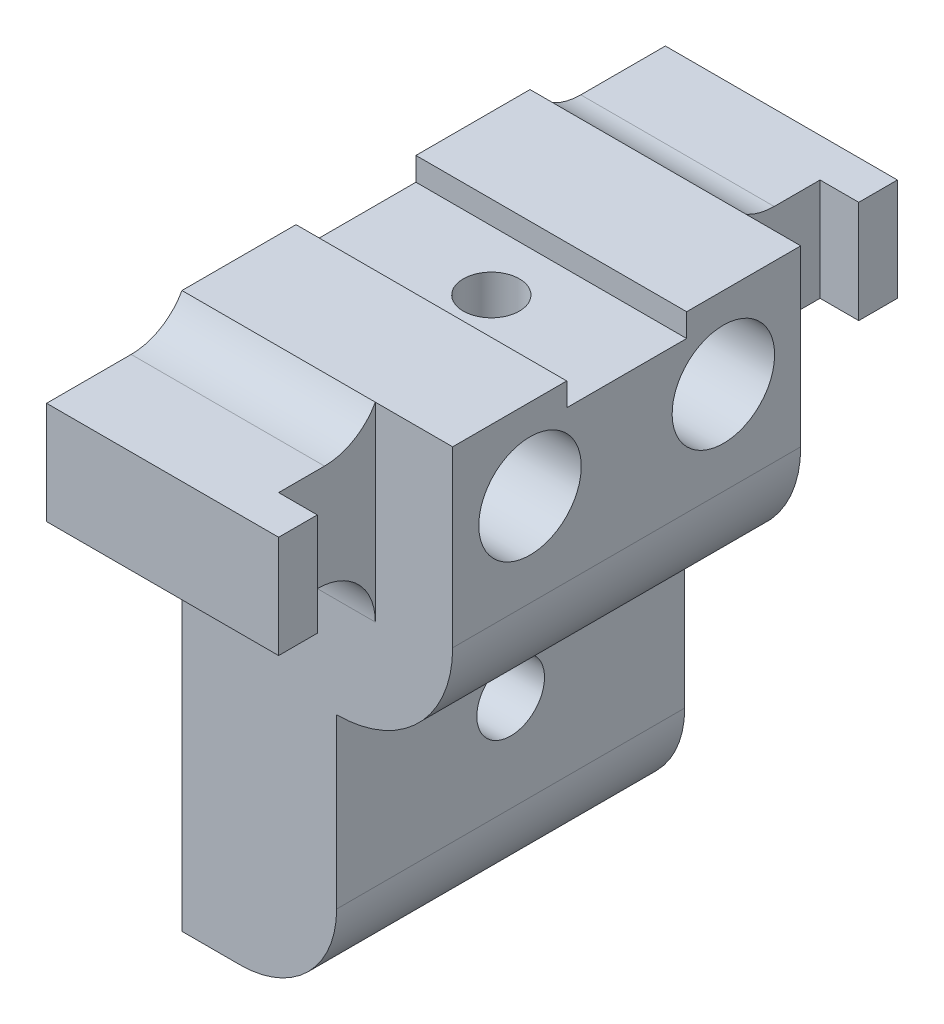
from build123d import *

# Parameters (mm, degrees)
SKETCH1_W               = 6
SKETCH1_H               = 15
SKETCH1_W_2             = 8
SKETCH1_H_2             = 28.7
BOSS_EXTRUDE1_DEPTH     = 9
SKETCH2_R               = 2.65
CUT_EXTRUDE1_DEPTH      = 34.176648414
SKETCH5_W               = 10
SKETCH5_H               = 5.3
BOSS_EXTRUDE4_DEPTH     = 5
SKETCH6_W               = 12
SKETCH6_H               = 5.3
BOSS_EXTRUDE5_DEPTH     = 2
SKETCH7_W               = 14
SKETCH7_H               = 6.2
CUT_EXTRUDE2_DEPTH      = 1.2
SKETCH8_R               = 1.45
CUT_EXTRUDE3_DEPTH      = 8
CUT_EXTRUDE4_DEPTH      = 36.716802768
CUT_EXTRUDE4_DEPTH_BACK = 36.716802768
SKETCH9_R               = 1.75
FILLET1_R               = 5
FILLET2_R               = 6
FILLET3_R               = 3


# Some blends are built 0.0001 mm under size
with BuildPart() as part:
    # Sketch1 → Boss-Extrude1 (new, symmetric)
    with BuildSketch(Plane.XY):
        with Locations((11, -7.5)):
            Rectangle(SKETCH1_W, SKETCH1_H)
        with Locations((4, -14.35)):
            Rectangle(SKETCH1_W_2, SKETCH1_H_2)
    extrude(amount=BOSS_EXTRUDE1_DEPTH, both=True)

    # Sketch2 → Cut-Extrude1 (cut, through all)
    with BuildSketch(Plane(origin=(14, 0, 0), x_dir=(0, 0, -1), z_dir=(1, 0, 0))):
        with Locations(Location((5, -4.2, 0), (0, 0, 90))):
            Circle(SKETCH2_R)
        with Locations(Location((-5, -4.2, 0), (0, 0, 90))):
            Circle(SKETCH2_R)
    extrude(amount=-CUT_EXTRUDE1_DEPTH, mode=Mode.SUBTRACT)

    # Sketch5 → Boss-Extrude4 (add)
    with BuildSketch(Plane.XY.offset(9)):
        with Locations((5, -4.2)):
            Rectangle(SKETCH5_W, SKETCH5_H)
    boss_extrude4 = extrude(amount=BOSS_EXTRUDE4_DEPTH)

    # Sketch6 → Boss-Extrude5 (add)
    with BuildSketch(Plane.XY.offset(14)):
        with Locations((6, -4.2)):
            Rectangle(SKETCH6_W, SKETCH6_H)
    boss_extrude5 = extrude(amount=BOSS_EXTRUDE5_DEPTH)

    # Mirror2: Boss-Extrude4, Boss-Extrude5 across plane
    add(boss_extrude4.mirror(Plane.XY))
    add(boss_extrude5.mirror(Plane.XY))

    # Sketch7 → Cut-Extrude2 (cut)
    with BuildSketch(Plane(origin=(0, 0, 0), x_dir=(1, 0, 0), z_dir=(0, 1, 0))):
        with Locations((7, 0)):
            Rectangle(SKETCH7_W, SKETCH7_H)
    extrude(amount=-CUT_EXTRUDE2_DEPTH, mode=Mode.SUBTRACT)

    # Sketch8 → Cut-Extrude3 (cut)
    with BuildSketch(Plane(origin=(0, -1.2, 0), x_dir=(1, 0, 0), z_dir=(0, 1, 0))):
        with Locations(Location((7, 0, 0), (0, 0, 270))):
            Circle(SKETCH8_R)
    extrude(amount=-CUT_EXTRUDE3_DEPTH, mode=Mode.SUBTRACT)

    # Sketch9 → Cut-Extrude4 (cut, two sides: drawn at the far end of the back side and taken through both)
    with BuildSketch(Plane.ZY.offset(-CUT_EXTRUDE4_DEPTH_BACK)):
        with Locations(Location((0, -18.7, 0), (0, 0, 90))):
            Circle(SKETCH9_R)
    extrude(amount=CUT_EXTRUDE4_DEPTH + CUT_EXTRUDE4_DEPTH_BACK, mode=Mode.SUBTRACT)

    # Fillet1
    fillet1_edges = [part.edges().sort_by_distance(p)[0] for p in [
        (8, -28.7, 0),
    ]]
    fillet(fillet1_edges, radius=FILLET1_R)

    # Fillet2
    fillet2_edges = [part.edges().sort_by_distance(p)[0] for p in [
        (14, -15, 0),
    ]]
    fillet(fillet2_edges, radius=FILLET2_R - 0.0001)  # a hair under: the kernel refuses the full size

    # Fillet3
    # the kernel refuses this fillet: 3 mm, written as the material it adds along each edge
    with BuildSketch(Plane(origin=(10, -6.85, 9), x_dir=(0, -1, 0), z_dir=(-1, 0, 0))) as fillet3_piece_1:
        with BuildLine():
            CenterArc((FILLET3_R, FILLET3_R), FILLET3_R, 180, 90)
            Line((0, FILLET3_R), (-FILLET3_R * 0.02, FILLET3_R))
            Line((-FILLET3_R * 0.02, FILLET3_R), (-FILLET3_R * 0.02, -FILLET3_R * 0.02))
            Line((-FILLET3_R * 0.02, -FILLET3_R * 0.02), (FILLET3_R, -FILLET3_R * 0.02))
            Line((FILLET3_R, -FILLET3_R * 0.02), (FILLET3_R, 0))
        make_face()
    extrude(amount=10)
    with BuildSketch(Plane(origin=(0, -1.55, 9), x_dir=(0, 1, 0), z_dir=(1, 0, 0))) as fillet3_piece_2:
        with BuildLine():
            CenterArc((3, 2.626309197), FILLET3_R, 180, 61.09666546)
            Line((0, 2.626309197), (-0.06, 2.626309197))
            Line((-0.06, 2.626309197), (-0.06, 0))
            Line((-0.06, 0), (0, -0.06))
            ThreePointArc((0, -0.06), (0.775, -0.06), (1.521, -0.052526184))
            Line((1.521, -0.052526184), (1.55, 0))
        make_face()
    extrude(amount=10)
    with BuildSketch(Plane(origin=(10, -6.85, -9), x_dir=(0, -1, 0), z_dir=(-1, 0, 0))) as fillet3_piece_3:
        with BuildLine():
            CenterArc((FILLET3_R, -FILLET3_R), FILLET3_R, 90, 90)
            Line((0, -FILLET3_R), (-FILLET3_R * 0.02, -FILLET3_R))
            Line((-FILLET3_R * 0.02, -FILLET3_R), (-FILLET3_R * 0.02, FILLET3_R * 0.02))
            Line((-FILLET3_R * 0.02, FILLET3_R * 0.02), (FILLET3_R, FILLET3_R * 0.02))
            Line((FILLET3_R, FILLET3_R * 0.02), (FILLET3_R, 0))
        make_face()
    extrude(amount=10)
    with BuildSketch(Plane(origin=(0, -1.55, -9), x_dir=(0, 1, 0), z_dir=(1, 0, 0))) as fillet3_piece_4:
        with BuildLine():
            CenterArc((3, -2.626309197), FILLET3_R, 118.90333454, 61.09666546)
            Line((0, -2.626309197), (-0.06, -2.626309197))
            Line((-0.06, -2.626309197), (-0.06, 0))
            Line((-0.06, 0), (0, 0.06))
            ThreePointArc((0, 0.06), (0.775, 0.06), (1.521, 0.052526184))
            Line((1.521, 0.052526184), (1.55, 0))
        make_face()
    extrude(amount=10)


solid = part.part
